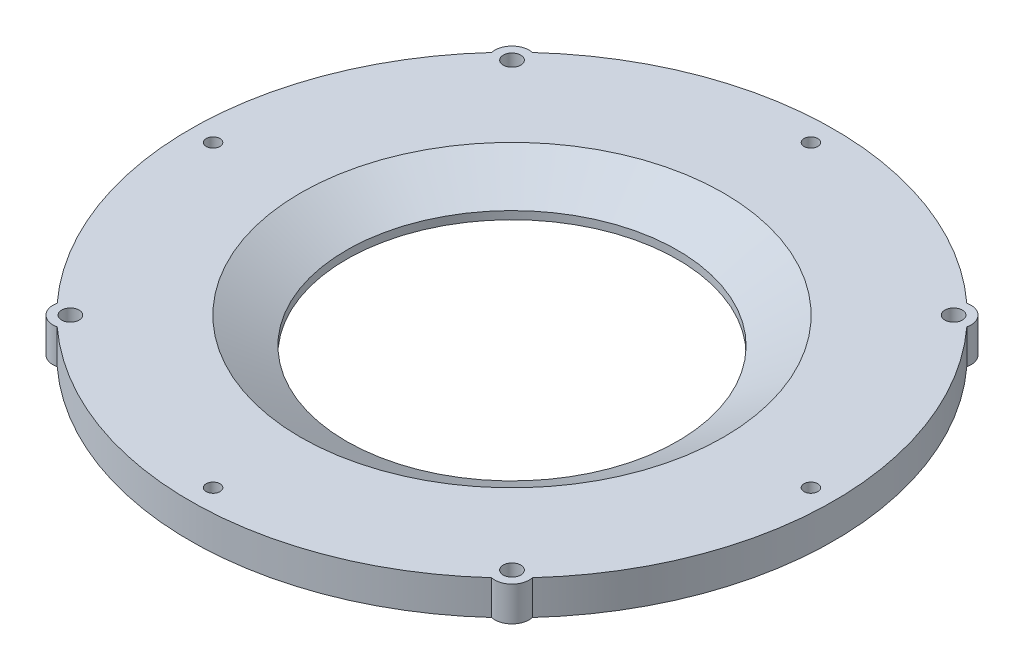
from build123d import *

# Parameters (mm, degrees)
SKETCH1_R           = 2.413
BOSS_EXTRUDE1_DEPTH = 9.525
SKETCH2_R           = 45.72
CUT_EXTRUDE1_DEPTH  = 12.7
SKETCH4_R           = 1.905
CUT_EXTRUDE3_DEPTH  = 12.7
CIRPATTERN2_COUNT   = 4
SKETCH10_R          = 0.6985
CUT_EXTRUDE5_DEPTH  = 3.175
CIRPATTERN5_COUNT   = 4
CHAMFER1_SIZE       = 12.7
CHAMFER1_SIZE2      = 7.332348419


with BuildPart() as part:
    # Sketch1 → Boss-Extrude1 (new body)
    with BuildSketch(Plane(origin=(0, 0, 0), x_dir=(1, 0, 0), z_dir=(0, 1, 0))):
        with BuildLine():
            ThreePointArc((-65.630087719, 59.965836824), (-88.9, 0), (-65.630087719, -59.965836824))
            ThreePointArc((-65.630087719, -59.965836824), (-64.343535107, -64.343535107), (-59.965836824, -65.630087719))
            ThreePointArc((-59.965836824, -65.630087719), (0, -88.9), (59.965836824, -65.630087719))
            ThreePointArc((59.965836824, -65.630087719), (64.343535107, -64.343535107), (65.630087719, -59.965836824))
            ThreePointArc((65.630087719, -59.965836824), (88.9, 0), (65.630087719, 59.965836824))
            ThreePointArc((65.630087719, 59.965836824), (64.343535107, 64.343535107), (59.965836824, 65.630087719))
            ThreePointArc((59.965836824, 65.630087719), (0, 88.9), (-59.965836824, 65.630087719))
            ThreePointArc((-59.965836824, 65.630087719), (-64.343535107, 64.343535107), (-65.630087719, 59.965836824))
        make_face()
        with Locations((-60.975939062, 60.975939062)):
            Circle(SKETCH1_R, mode=Mode.SUBTRACT)
        with Locations((60.975939062, 60.975939062)):
            Circle(SKETCH1_R, mode=Mode.SUBTRACT)
        with Locations((60.975939062, -60.975939062)):
            Circle(SKETCH1_R, mode=Mode.SUBTRACT)
        with Locations((-60.975939062, -60.975939062)):
            Circle(SKETCH1_R, mode=Mode.SUBTRACT)
    extrude(amount=BOSS_EXTRUDE1_DEPTH)

    # Sketch2 → Cut-Extrude1 (cut)
    with BuildSketch(Plane(origin=(0, 9.525, 0), x_dir=(1, 0, 0), z_dir=(0, 1, 0))):
        Circle(SKETCH2_R)
    extrude(amount=-CUT_EXTRUDE1_DEPTH, mode=Mode.SUBTRACT)

    # Sketch4 → Cut-Extrude3 (cut)
    with BuildSketch(Plane(origin=(0, 9.525, 0), x_dir=(1, 0, 0), z_dir=(0, 1, 0))):
        with Locations((0, 82.55)):
            Circle(SKETCH4_R)
    cut_extrude3 = extrude(amount=-CUT_EXTRUDE3_DEPTH, mode=Mode.SUBTRACT)

    # CirPattern2: Cut-Extrude3 ×4 about axis
    cirpattern2_axis = Axis((0, 9.525, 0), (0, 1, 0))
    for i in range(1, CIRPATTERN2_COUNT):
        add(cut_extrude3.rotate(cirpattern2_axis, i * 360 / CIRPATTERN2_COUNT), mode=Mode.SUBTRACT)

    # Sketch10 → Cut-Extrude5 (cut)
    with BuildSketch(Plane(origin=(-62.861792847, 0, -62.861792847), x_dir=(0, -1, 0), z_dir=(-0.7071067811865464, 0, -0.7071067811865488))):
        with Locations((-4.826, 0)):
            Circle(SKETCH10_R)
    cut_extrude5 = extrude(amount=-CUT_EXTRUDE5_DEPTH, mode=Mode.SUBTRACT)

    # CirPattern5: Cut-Extrude5 ×4 about axis
    cirpattern5_axis = Axis((0, 9.525, 0), (0, 1, 0))
    for i in range(1, CIRPATTERN5_COUNT):
        add(cut_extrude5.rotate(cirpattern5_axis, i * 360 / CIRPATTERN5_COUNT), mode=Mode.SUBTRACT)

    # Chamfer1
    chamfer1_edges = [part.edges().sort_by_distance(p)[0] for p in [
        (-45.72, 9.525, 0),
    ]]
    chamfer1_side = [part.faces().sort_by_distance(p)[0] for p in [
        (-86.385528286, 9.525, 0),
    ]]
    chamfer(chamfer1_edges, length=CHAMFER1_SIZE, length2=CHAMFER1_SIZE2, reference=chamfer1_side[0])


solid = part.part
